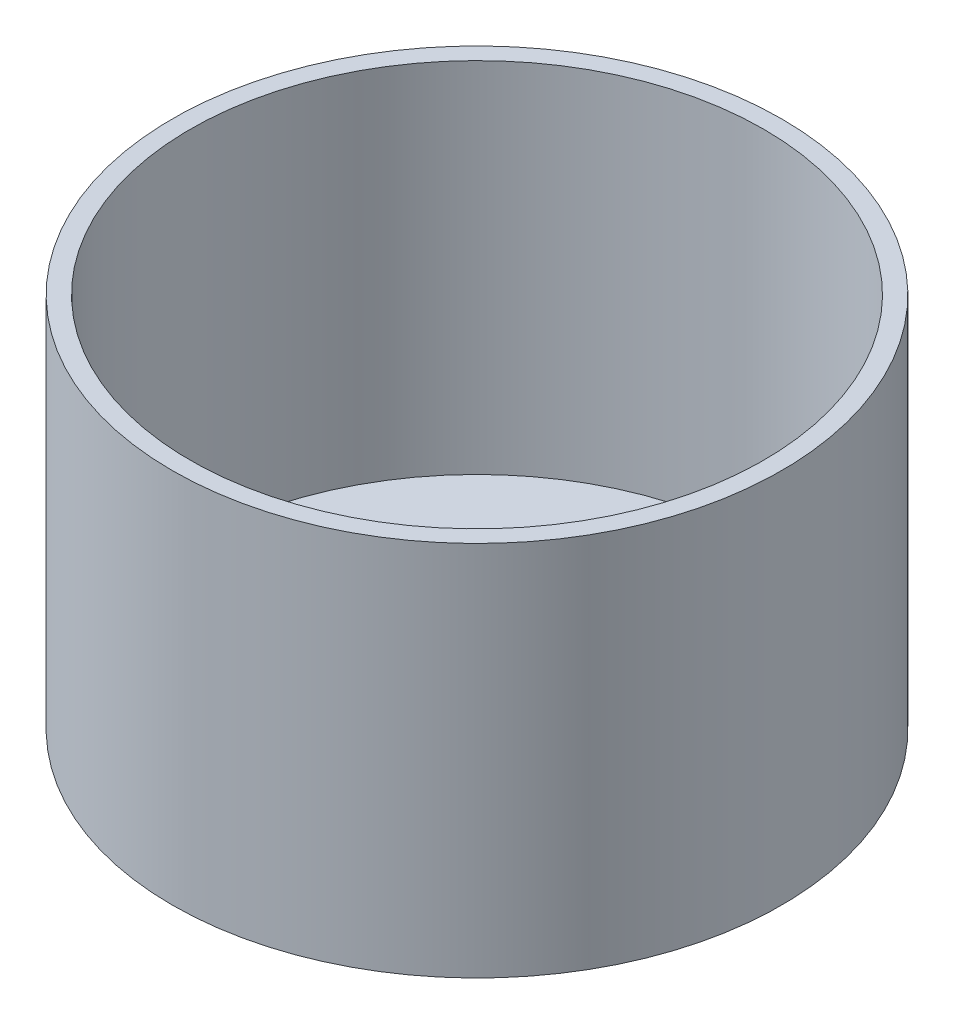
from build123d import *

# Parameters (mm, degrees)
CUT_EXTRUDE2_REACH = 161.609
MOTOR_HOLE_R       = 4.5


with BuildPart() as part:
    # Compartment → Revolve1 (revolve)
    with BuildSketch(Plane.XY):
        Polygon((85, -80), (0, -80), (0, -75), (80, -75), (80, 25), (85, 25), align=None)
    revolve(axis=Axis((0, 0, 0), (0, 1, 0)))

    # Motor Hole → Cut-Extrude2 (cut, up to next)
    with BuildSketch(Plane.XZ.offset(80), mode=Mode.PRIVATE) as cut_extrude2_sk1:
        Circle(MOTOR_HOLE_R)
    cut_extrude2_tool1 = extrude(cut_extrude2_sk1.sketch, amount=-CUT_EXTRUDE2_REACH, mode=Mode.PRIVATE) & part.part
    add(cut_extrude2_tool1.solids().sort_by_distance((0, -80, 0))[0], mode=Mode.SUBTRACT)


solid = part.part
